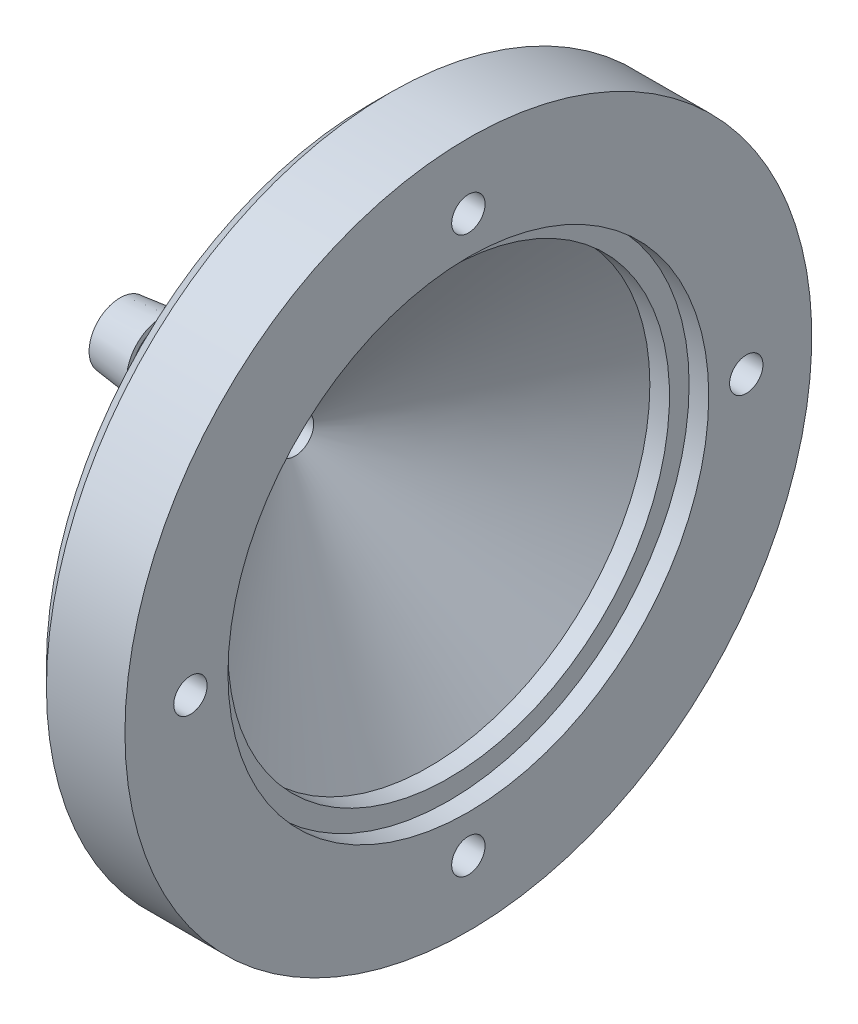
from build123d import *

# Parameters (mm, degrees)
CBORE_FOR_M3_HEX_SOCKET_HEAD_CAP_SCREW2_D           = 3.4
CBORE_FOR_M3_HEX_SOCKET_HEAD_CAP_SCREW2_DEPTH       = 10
CBORE_FOR_M3_HEX_SOCKET_HEAD_CAP_SCREW2_CBORE_D     = 6.5
CBORE_FOR_M3_HEX_SOCKET_HEAD_CAP_SCREW2_CBORE_DEPTH = 3.4
CBORE_FOR_M3_HEX_SOCKET_HEAD_CAP_SCREW2_TIP         = 1.021463052
CHAMFER1_SIZE                                       = 2


with BuildPart() as part:
    # Sketch1 → Revolve17 (revolve)
    with BuildSketch(Plane.XY):
        Polygon((-13.50584799, 3.65), (-13.50584799, 3.15), (-9.172514657, 3.65), (-9.172514657, 3.15), (-4.839181323, 3.65), (7.664494136, 22.5), (7.664494136, 35), (17.664494136, 35), (17.664494136, 24.5), (15.664494136, 24.5), (15.664494136, 22.5), (13.664494136, 22.5), (0, 1.9), (-17.839181323, 1.9), (-17.839181323, 3.15), align=None)
    revolve(axis=Axis((-801.920554309, 0, 0), (1, 0, 0)))

    # CBORE for M3 Hex Socket Head Cap Screw2
    with Locations(Plane.ZY.offset(-7.664494136)):
        with Locations((0, -28.325), (0, 28.325), (28.325, 0), (-28.325, 0)):
            CounterBoreHole(CBORE_FOR_M3_HEX_SOCKET_HEAD_CAP_SCREW2_D / 2, CBORE_FOR_M3_HEX_SOCKET_HEAD_CAP_SCREW2_CBORE_D / 2, CBORE_FOR_M3_HEX_SOCKET_HEAD_CAP_SCREW2_CBORE_DEPTH, depth=CBORE_FOR_M3_HEX_SOCKET_HEAD_CAP_SCREW2_DEPTH)
            with Locations((0, 0, -(CBORE_FOR_M3_HEX_SOCKET_HEAD_CAP_SCREW2_DEPTH + CBORE_FOR_M3_HEX_SOCKET_HEAD_CAP_SCREW2_TIP / 2))):  # 118° drill point
                Cone(0, CBORE_FOR_M3_HEX_SOCKET_HEAD_CAP_SCREW2_D / 2, CBORE_FOR_M3_HEX_SOCKET_HEAD_CAP_SCREW2_TIP, mode=Mode.SUBTRACT)

    # Chamfer1
    chamfer1_edges = [part.edges().sort_by_distance(p)[0] for p in [
        (7.664494136, -35, 0),
    ]]
    chamfer(chamfer1_edges, length=CHAMFER1_SIZE)


solid = part.part
